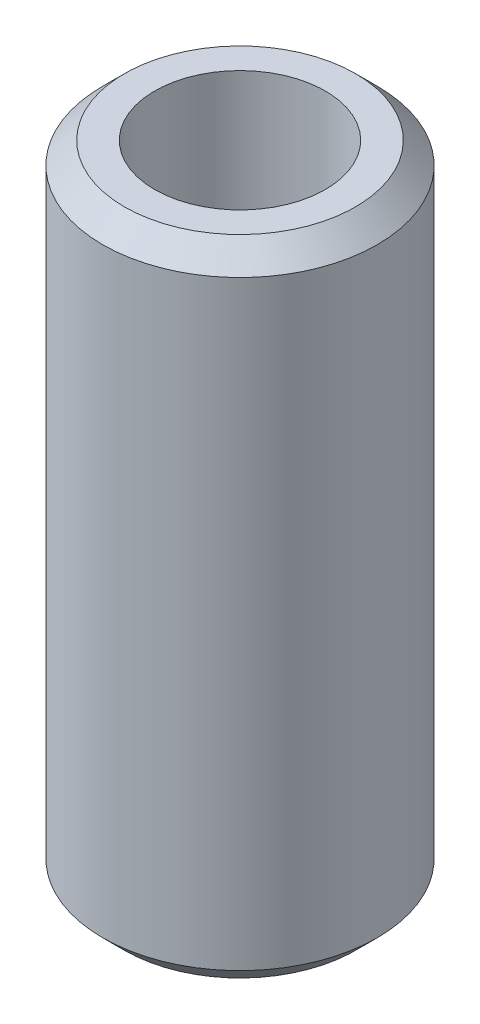
from build123d import *

# Parameters (mm, degrees)
SKETCH1_R           = 17.5
BOSS_EXTRUDE1_DEPTH = 82.072368377
SKETCH2_R           = 10.882326507
CUT_EXTRUDE1_DEPTH  = 86.722655413
CHAMFER1_SIZE       = 2.779443346


with BuildPart() as part:
    # Sketch1 → Boss-Extrude1 (new body)
    with BuildSketch(Plane(origin=(0, 0, 0), x_dir=(1, 0, 0), z_dir=(0, 1, 0))):
        Circle(SKETCH1_R)
    extrude(amount=BOSS_EXTRUDE1_DEPTH)

    # Sketch2 → Cut-Extrude1 (cut, through all)
    with BuildSketch(Plane(origin=(0, 0, 0), x_dir=(1, 0, 0), z_dir=(0, 1, 0))):
        Circle(SKETCH2_R)
    extrude(amount=CUT_EXTRUDE1_DEPTH, mode=Mode.SUBTRACT)

    # Chamfer1
    chamfer1_edges = [part.edges().sort_by_distance(p)[0] for p in [
        (-17.5, 82.072368377, 0),
        (-17.5, 0, 0),
    ]]
    chamfer(chamfer1_edges, length=CHAMFER1_SIZE)


solid = part.part
